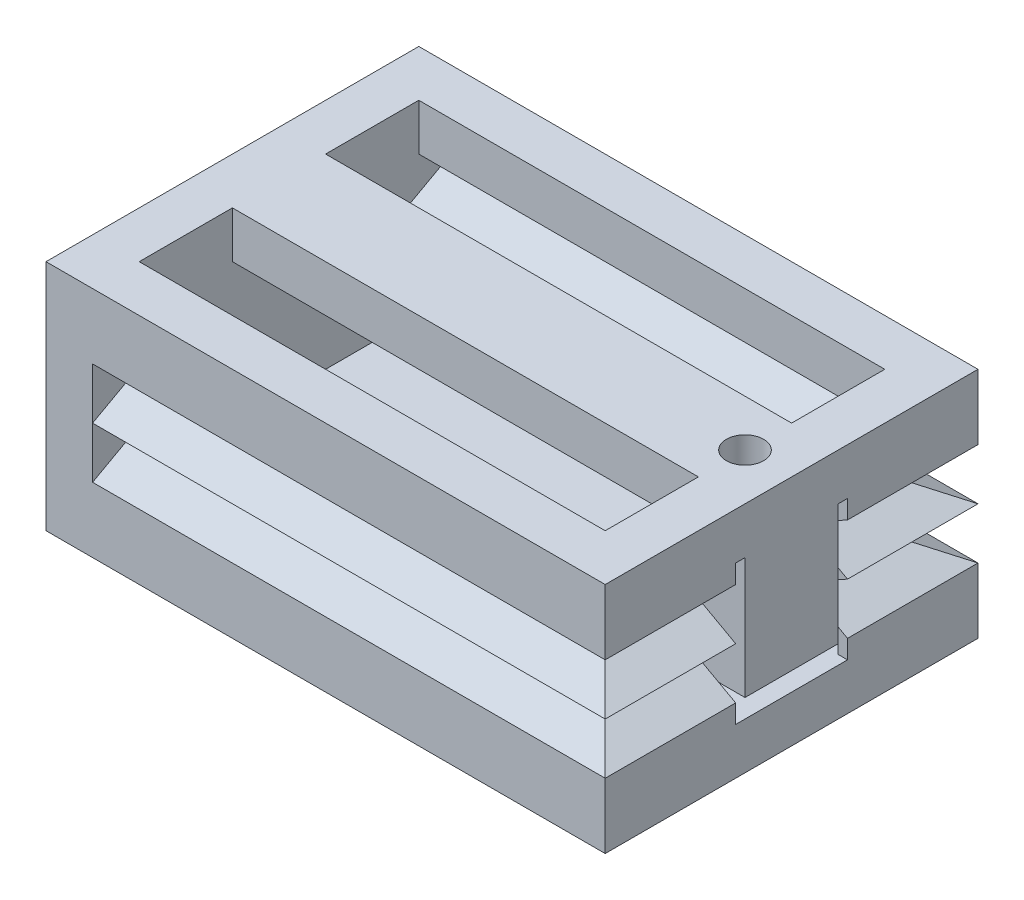
from build123d import *

# Parameters (mm, degrees)
BOSS_EXTRUDE1_DEPTH      = 2
BOSS_EXTRUDE1_DEPTH_BACK = 2
SKETCH2_W                = 1
SKETCH2_H                = 1
BOSS_EXTRUDE2_DEPTH      = 1.8
SKETCH4_R                = 0.2
CUT_EXTRUDE1_DEPTH       = 11.5
SKETCH5_W                = 5
SKETCH5_H                = 1
CUT_EXTRUDE2_DEPTH       = 1.5
SKETCH6_W                = 1.5
SKETCH6_H                = 1.5
CUT_EXTRUDE3_DEPTH       = 0.5
BOSS_EXTRUDE3_DEPTH      = 1.4
CUT_EXTRUDE4_DEPTH       = 1.4
BOSS_EXTRUDE4_REACH      = 14.133
BOSS_EXTRUDE4_START      = -5.5


with BuildPart() as part:
    # Sketch1 → Boss-Extrude1 (new, two sides: drawn at the far end of the back side and taken through both)
    with BuildSketch(Plane.XY.offset(-BOSS_EXTRUDE1_DEPTH_BACK)):
        Polygon((0, 0), (5.5, 0), (5.5, 0.5), (-0.5, 0.5), (-0.5, -2), (5.5, -2), (5.5, -1.5), (0, -1.5), align=None)
    extrude(amount=BOSS_EXTRUDE1_DEPTH + BOSS_EXTRUDE1_DEPTH_BACK)

    # Sketch2 → Boss-Extrude2 (add)
    with BuildSketch(Plane(origin=(0, 0.5, 0), x_dir=(1, 0, 0), z_dir=(0, 1, 0))):
        with Locations((5, 0)):
            Rectangle(SKETCH2_W, SKETCH2_H)
    extrude(amount=-BOSS_EXTRUDE2_DEPTH)

    # Sketch4 → Cut-Extrude1 (cut)
    with BuildSketch(Plane.XZ.offset(1.3)):
        with Locations((5, 0)):
            Circle(SKETCH4_R)
    extrude(amount=-CUT_EXTRUDE1_DEPTH, mode=Mode.SUBTRACT)

    # Sketch5 → Cut-Extrude2 (cut)
    with BuildSketch(Plane(origin=(0, 0.5, 0), x_dir=(1, 0, 0), z_dir=(0, 1, 0))):
        with Locations((2.5, 1)):
            Rectangle(SKETCH5_W, SKETCH5_H)
        with Locations((2.5, -1)):
            Rectangle(SKETCH5_W, SKETCH5_H)
    extrude(amount=-CUT_EXTRUDE2_DEPTH, mode=Mode.SUBTRACT)

    # Sketch6 → Cut-Extrude3 (cut)
    with BuildSketch(Plane.XZ.offset(2)):
        with Locations((3.903922347, 0)):
            Rectangle(SKETCH6_W, SKETCH6_H)
    extrude(amount=-CUT_EXTRUDE3_DEPTH, mode=Mode.SUBTRACT)

    # Sketch7 → Boss-Extrude3 (add)
    with BuildSketch(Plane.XY.offset(2)):
        Polygon((5.5, 0), (5.5, -0.2), (5, -0.475), (5.5, -0.75), (5, -1.025), (5.5, -1.3), (5.5, -1.5), (5.4, -1.5), (5.4, -1.359127122), (4.792496142, -1.025), (5.292496142, -0.75), (4.792496142, -0.475), (5.4, -0.140872878), (5.4, 0), align=None)
    boss_extrude3 = extrude(amount=-BOSS_EXTRUDE3_DEPTH)

    # Sketch8 → Cut-Extrude4 (cut)
    with BuildSketch(Plane(origin=(5.5, 0, 0), x_dir=(0, 0, -1), z_dir=(1, 0, 0))):
        Polygon((-2, -0.2), (-2.054224722, -0.75), (-2, -1.3), (-1.5, -1.025), (-2, -0.75), (-1.5, -0.475), align=None)
    cut_extrude4 = extrude(amount=-CUT_EXTRUDE4_DEPTH, mode=Mode.SUBTRACT)

    # Sketch9 → Boss-Extrude4 (add, up to next)
    with BuildSketch(Plane(origin=(5.5, 0, 0), x_dir=(0, 0, -1), z_dir=(1, 0, 0)).offset(BOSS_EXTRUDE4_START), mode=Mode.PRIVATE) as boss_extrude4_sk1:
        Polygon((-2, 0.5), (-2, -0.2), (-1.5, -0.475), (-2, -0.75), (-1.5, -1.025), (-2, -1.3), (-2, -2), (-1.9, -2), (-1.9, -1.359127122), (-1.292496142, -1.025), (-1.792496142, -0.75), (-1.292496142, -0.475), (-1.9, -0.140872878), (-1.9, 0.5), align=None)
    boss_extrude4_tool1 = extrude(boss_extrude4_sk1.sketch, amount=BOSS_EXTRUDE4_REACH, mode=Mode.PRIVATE) - part.part
    boss_extrude4 = boss_extrude4_tool1.solids().sort_by_distance((0, 0.15, 1.974018))[0]
    add(boss_extrude4)

    # Mirror1: Boss-Extrude3, Cut-Extrude4, Boss-Extrude4 across plane
    add(boss_extrude3.mirror(Plane.XY))
    add(cut_extrude4.mirror(Plane.XY), mode=Mode.SUBTRACT)
    add(boss_extrude4.mirror(Plane.XY))


solid = part.part
